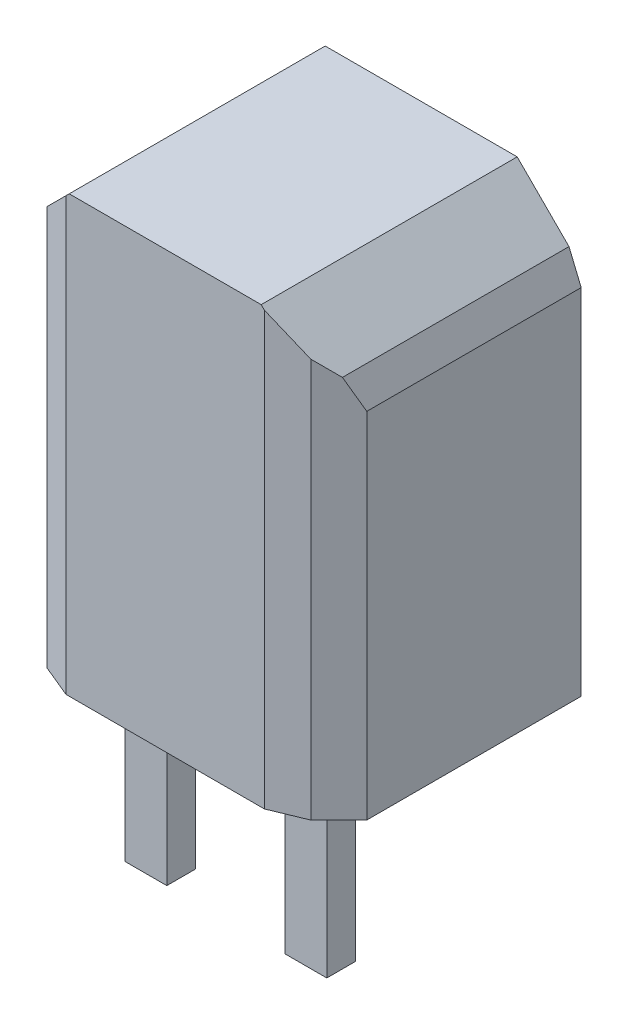
from build123d import *

# Parameters (mm, degrees)
Y_KSEKLIK_EKSTR_ZYON1_DEPTH = 4
PAH2_SIZE                   = 0.65
PAH7_SIZE                   = 0.3
PAH8_SIZE                   = 0.3
IZIM2_W                     = 0.65
IZIM2_H                     = 0.45
Y_KSEKLIK_EKSTR_ZYON2_DEPTH = 2.75


with BuildPart() as part:
    # Çizim1 → Yükseklik-Ekstrüzyon1 (new body)
    with BuildSketch(Plane.XY):
        Polygon((0, 0), (5, 0), (5, 5.8), (4, 6.8), (1, 6.8), (0, 5.8), align=None)
    extrude(amount=Y_KSEKLIK_EKSTR_ZYON1_DEPTH)

    # Pah2
    pah2_edges = [part.edges().sort_by_distance(p)[0] for p in [
        (5, 2.9, 4),
        (0, 2.9, 4),
    ]]
    chamfer(pah2_edges, length=PAH2_SIZE)

    # Pah3
    # the kernel refuses this chamfer: 0.65 mm, written as the material it takes off along each edge
    with BuildSketch(Plane(origin=(0, 5.8, -0.733571059), x_dir=(-0.033908675640741216, -0.9994249355085608, 0), z_dir=(0, 0, 1))) as pah3_piece_1:
        with BuildLine():
            Line((0.293428424, 0), (-0.221071103, 0.192945089))
            Line((-0.221071103, 0.192945089), (-0.229946503, 0.183446285))
            ThreePointArc((-0.229946503, 0.183446285), (-0.116014483, 0.090608776), (-0.0088754, -0.009498804))
            Line((-0.0088754, -0.009498804), (0.000440813, -0.012992524))
            ThreePointArc((0.000440813, -0.012992524), (0.146986333, -0.0080205), (0.293869236, -0.012992524))
            Line((0.293869236, -0.012992524), (0.293428424, 0))
        make_face()
    extrude(amount=4.817142118, mode=Mode.SUBTRACT)

    # Pah4
    # the kernel refuses this chamfer: 0.65 mm, written as the material it takes off along each edge
    with BuildSketch(Plane(origin=(5, 5.8, -0.733571059), x_dir=(0.03390867564074173, -0.9994249355085608, 0), z_dir=(0, 0, 1))) as pah4_piece_1:
        with BuildLine():
            Line((0.293428424, 0), (-0.221071103, -0.192945089))
            Line((-0.221071103, -0.192945089), (-0.229946503, -0.183446285))
            ThreePointArc((-0.229946503, -0.183446285), (-0.116014483, -0.090608776), (-0.0088754, 0.009498804))
            Line((-0.0088754, 0.009498804), (0.000440813, 0.012992524))
            ThreePointArc((0.000440813, 0.012992524), (0.146986333, 0.0080205), (0.293869236, 0.012992524))
            Line((0.293869236, 0.012992524), (0.293428424, 0))
        make_face()
    extrude(amount=4.817142118, mode=Mode.SUBTRACT)

    # Pah7
    pah7_edges = [part.edges().sort_by_distance(p)[0] for p in [
        (0.65, 3.225, 4),
    ]]
    chamfer(pah7_edges, length=PAH7_SIZE)

    # Pah8
    pah8_edges = [part.edges().sort_by_distance(p)[0] for p in [
        (4.35, 3.225, 4),
    ]]
    chamfer(pah8_edges, length=PAH8_SIZE)

    # Çizim2 → Yükseklik-Ekstrüzyon2 (add)
    with BuildSketch(Plane.XZ):
        with Locations((1.25, 2.825)):
            Rectangle(IZIM2_W, IZIM2_H)
        with Locations((3.75, 2.825)):
            Rectangle(IZIM2_W, IZIM2_H)
    extrude(amount=Y_KSEKLIK_EKSTR_ZYON2_DEPTH)


solid = part.part
